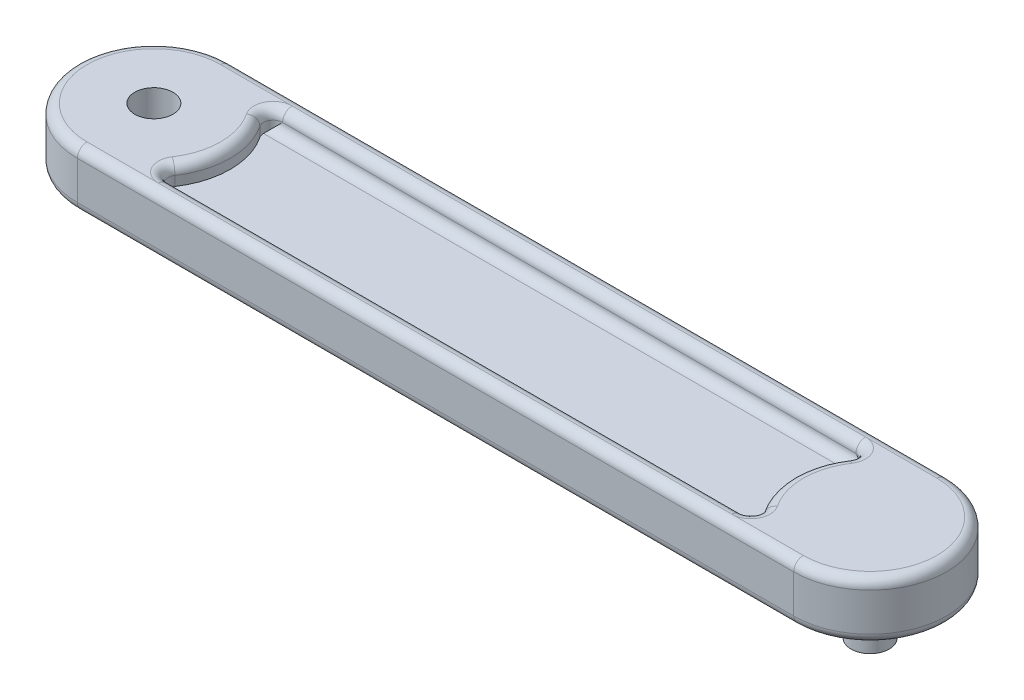
from build123d import *

# Parameters (mm, degrees)
BOSS_EXTRUDE1_DEPTH   = 6
BODY_MOVE_COPY1_ANGLE = 90
SKETCH11_R            = 2.5
BOSS_EXTRUDE7_DEPTH   = 5
CUT_EXTRUDE6_START    = -4
SKETCH12_R            = 2.5
SKETCH12_R_2          = 2
CUT_EXTRUDE6_DEPTH    = 4
SKETCH9_R             = 2
CUT_EXTRUDE7_DEPTH    = 10
BODY_MOVE_COPY2_ANGLE = 180
CUT_EXTRUDE8_START    = -2
CUT_EXTRUDE8_DEPTH    = 2
FILLET1_R             = 1
CUT_EXTRUDE9_DEPTH    = 2
FILLET2_R             = 1


with BuildPart() as part:
    # Sketch1 → Boss-Extrude1 (new body)
    with BuildSketch(Plane.XY):
        with BuildLine():
            Line((0, 8), (75, 8))
            ThreePointArc((75, 8), (83, 0), (75, -8))
            Line((75, -8), (0, -8))
            ThreePointArc((0, -8), (-8, 0), (0, 8))
        make_face()
    extrude(amount=BOSS_EXTRUDE1_DEPTH)


with BuildPart() as part_1:
    # Body-Move/Copy1: moved
    add(part.part.rotate(Axis((0, 0, 11), (-1, 0, 0)), BODY_MOVE_COPY1_ANGLE))

    # Sketch11 → Boss-Extrude7 (add)
    with BuildSketch(Plane(origin=(0, -5, 0), x_dir=(1, 0, 0), z_dir=(0, 1, 0))):
        with Locations(Location((75, -11, 0), (0, 0, 270))):
            Circle(SKETCH11_R)
    extrude(amount=BOSS_EXTRUDE7_DEPTH)

    # Sketch12 → Cut-Extrude6 (cut)
    with BuildSketch(Plane(origin=(0, 0, 0), x_dir=(1, 0, 0), z_dir=(0, 1, 0)).offset(CUT_EXTRUDE6_START)):
        with Locations(Location((75, -11, 0), (0, 0, 270))):
            Circle(SKETCH12_R)
        with Locations(Location((75, -11, 0), (0, 0, 270))):
            Circle(SKETCH12_R_2, mode=Mode.SUBTRACT)
    extrude(amount=CUT_EXTRUDE6_DEPTH, mode=Mode.SUBTRACT)

    # Sketch9 → Cut-Extrude7 (cut)
    with BuildSketch(Plane.XZ.offset(11)):
        with Locations(Location((0, 11, 0), (0, 0, 270))):
            Circle(SKETCH9_R)
    extrude(amount=-CUT_EXTRUDE7_DEPTH, mode=Mode.SUBTRACT)


with BuildPart() as part_2:
    # Body-Move/Copy2: moved
    add(part_1.part.rotate(Axis((0, -5.5, 11), (1, 0, 0)), BODY_MOVE_COPY2_ANGLE))

    # Sketch13 → Cut-Extrude8 (cut)
    with BuildSketch(Plane.XZ.offset(6).offset(CUT_EXTRUDE8_START)):
        with BuildLine():
            Line((63, 5), (69.708497378, 5))
            ThreePointArc((69.708497378, 5), (67, 11), (69.708497378, 17))
            Line((69.708497378, 17), (63, 17))
            Line((63, 17), (12, 17))
            Line((12, 17), (5.291502622, 17))
            ThreePointArc((5.291502622, 17), (8, 11), (5.291502622, 5))
            Line((5.291502622, 5), (12, 5))
            Line((12, 5), (63, 5))
        make_face()
    extrude(amount=CUT_EXTRUDE8_DEPTH, mode=Mode.SUBTRACT)

    # Fillet1
    fillet1_edges = [part_2.edges().sort_by_distance(p)[0] for p in [
        (37.5, -6, 3),
        (83, -6, 11),
        (8, -6, 11),
        (5.291502622, -5, 5),
        (37.5, -6, 17),
        (5.291502622, -5, 17),
        (67, -6, 11),
        (69.708497378, -5, 17),
        (37.5, -6, 5),
        (69.708497378, -5, 5),
        (8, -4, 11),
        (37.5, -4, 17),
        (67, -4, 11),
        (37.5, -4, 5),
        (37.5, -6, 19),
        (-8, -6, 11),
    ]]
    fillet(fillet1_edges, radius=FILLET1_R - 0.0001)  # a hair under: the kernel refuses the full size

    # Sketch14 → Cut-Extrude9 (cut)
    with BuildSketch(Plane(origin=(0, 0, 0), x_dir=(1, 0, 0), z_dir=(0, 1, 0))):
        with BuildLine():
            Line((67, -5), (69.708497378, -5))
            ThreePointArc((69.708497378, -5), (67, -11), (69.708497378, -17))
            Line((69.708497378, -17), (67, -17))
            Line((67, -17), (5.291502622, -17))
            ThreePointArc((5.291502622, -17), (8, -11), (5.291502622, -5))
            Line((5.291502622, -5), (67, -5))
        make_face()
    extrude(amount=-CUT_EXTRUDE9_DEPTH, mode=Mode.SUBTRACT)

    # Fillet2
    fillet2_edges = [part_2.edges().sort_by_distance(p)[0] for p in [
        (37.5, -2, 5),
        (5.291502622, -1, 5),
        (69.708497378, -1, 5),
        (37.5, -2, 17),
        (69.708497378, -1, 17),
        (5.291502622, -1, 17),
        (37.5, 0, 5),
        (8, 0, 11),
        (37.5, 0, 17),
        (67, 0, 11),
        (83, 0, 11),
        (37.5, 0, 3),
        (-8, 0, 11),
        (37.5, 0, 19),
    ]]
    fillet(fillet2_edges, radius=FILLET2_R - 0.0001)  # a hair under: the kernel refuses the full size


solid = part_2.part
